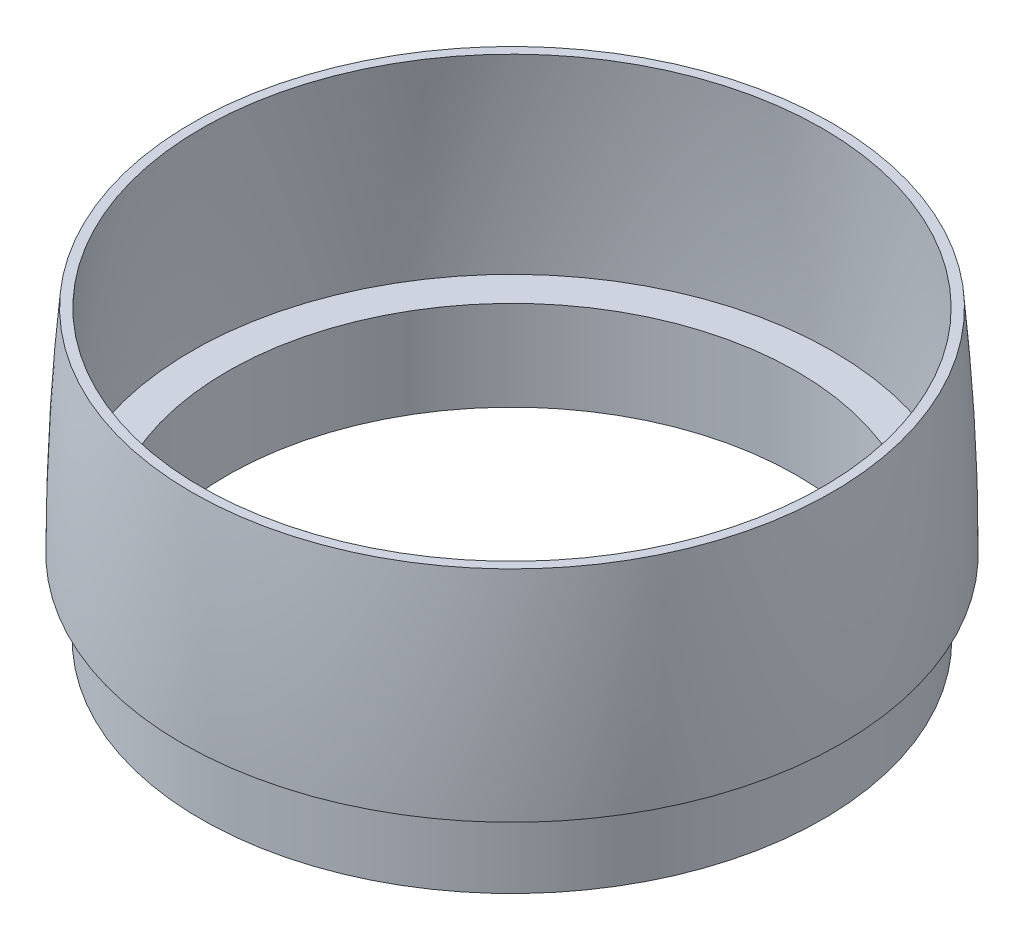
from build123d import *

# Parameters (mm, degrees)
CUT_EXTRUDE1_DEPTH      = 99
CUT_EXTRUDE1_DEPTH_BACK = 88
SKETCH4_W               = 266.209383107
SKETCH4_H               = 134.652420525


with BuildPart() as part:
    # Sketch1 → Revolve1 (revolve)
    with BuildSketch(Plane.XY):
        with BuildLine():
            Line((41.5, 0), (44, 0))
            add(Edge.make_bspline(
                [(0, 150), (10.377007682, 150), (44, 82.440338786), (44, 0)],
                knots=[0, 0, 0, 0, 1, 1, 1, 1], degree=3))
            Line((0, 150), (0, 148.75))
            add(Edge.make_bspline(
                [(0, 148.75), (0.090206504, 148.75), (0.249616768, 148.734406443), (0.725504975, 148.610456703), (1.490290332, 148.236213717), (2.626865312, 147.393188573), (4.346875012, 145.755340423), (6.800556036, 142.78052287), (10.075721714, 137.836599335), (13.580729048, 131.610663538), (18.438951872, 121.712395256), (24.643204335, 106.547112324), (31.629879613, 84.50668874), (36.520788443, 63.451706754), (39.546536694, 45.300649611), (41.290535124, 31.112723821), (42.238019209, 18.866088219), (42.63892269, 9.178051867), (42.727106679, 4.356392588), (42.742974567, 2.062464848), (42.743387294, 2)],
                knots=[0, 0, 0, 0, 0.015545629, 0.031091258, 0.062182516, 0.093273775, 0.124365033, 0.186547549, 0.248730066, 0.310912582, 0.373095099, 0.497460132, 0.621825165, 0.746190198, 0.808372714, 0.870555231, 0.932737747, 0.963829006, 0.991104807, 0.991867899, 0.991867899, 0.991867899, 0.991867899], degree=3))
            Line((42.743387294, 2), (38, 2))
            Line((38, 2), (38, -10))
            Line((38, -10), (41.5, -10))
            Line((41.5, -10), (41.5, 0))
        make_face()
    revolve(axis=Axis((0, 0, 0), (0, 1, 0)))

    # Sketch4 → Cut-Extrude1 (cut, two sides: drawn at the far end of the back side and taken through both)
    with BuildSketch(Plane.XY.offset(-CUT_EXTRUDE1_DEPTH_BACK)):
        with Locations((-2.432145526, 95.690777697)):
            Rectangle(SKETCH4_W, SKETCH4_H)
    extrude(amount=CUT_EXTRUDE1_DEPTH + CUT_EXTRUDE1_DEPTH_BACK, mode=Mode.SUBTRACT)


solid = part.part
